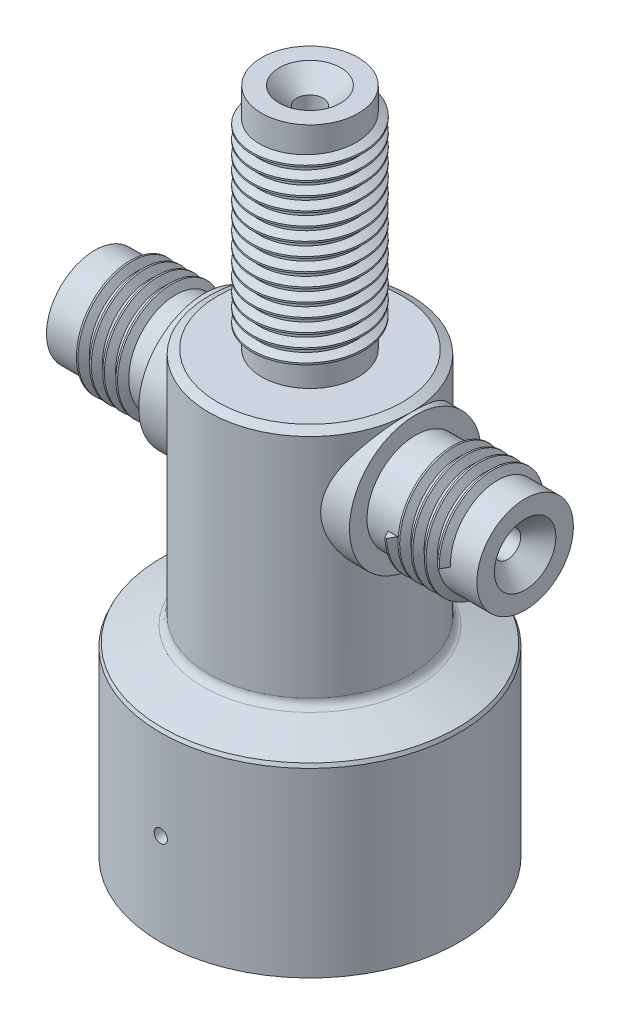
from build123d import *

# Parameters (mm, degrees)
CHAMFER_1_SIZE      = 0.2
CHAMFER_1_SIZE2     = 0.334631437
FILLET_2_R          = 1
SKETCH_7_R          = 5.5
EXTRUDE_3_DEPTH     = 24.5
EXTRUDE_START       = -24.5
SKETCH_8_R          = 5.5
EXTRUDE_4_DEPTH     = 24.5
SKETCH_9_R          = 7.5
EXTRUDE_5_DEPTH     = 12
EXTRUDE_START_2     = -12
SKETCH_10_R         = 7.5
EXTRUDE_6_DEPTH     = 12
THREAD_1_PITCH      = 1.5
THREAD_2_PITCH      = 1.5
THREAD_3_PITCH      = 1.5
SKETCH_24_R         = 1.5
CUT_EXTRUDE_1_DEPTH = 10
CHAMFER_2_SIZE      = 2
SKETCH_25_R         = 1.5
CUT_EXTRUDE_2_DEPTH = 82.6409825
CHAMFER_3_SIZE      = 2
CUT_EXTRUDE_START   = -10
SKETCH_26_R         = 1.5
CUT_EXTRUDE_3_DEPTH = 10
CHAMFER_4_SIZE      = 2
SKETCH_27_R         = 13
CUT_EXTRUDE_4_DEPTH = 16
CHAMFER_5_SIZE      = 0.8
CHAMFER_5_SIZE2     = 0.461880215
THREAD_4_PITCH      = 1.5
SKETCH_32_R         = 9
CUT_EXTRUDE_5_DEPTH = 20
SKETCH_33_R         = 11.5
SKETCH_33_R_2       = 10
EXTRUDE_8_DEPTH     = 1
FILLET_3_R          = 0.4
CHAMFER_6_SIZE2     = 0.577350269
CHAMFER_6_SIZE      = 1
SKETCH_34_R         = 5
CUT_EXTRUDE_7_DEPTH = 6
SKETCH_35_R         = 3
SKETCH_35_R_2       = 1.5
EXTRUDE_9_DEPTH     = 1
FILLET_5_R          = 1
SKETCH_36_R         = 0.75
CUT_EXTRUDE_8_DEPTH = 11
CHAMFER_7_SIZE2     = 0.5
CHAMFER_7_SIZE      = 1


with BuildPart() as part:
    # Sketch 2 → Повернуть2 (revolve)
    with BuildSketch(Plane.XY, mode=Mode.PRIVATE) as revolve_2_sk:
        Polygon((0, 0), (-17, 0), (-17, 21), (-11.5, 23.001836288), (-11.5, 50), (-5.5, 50), (-5.5, 76), (0, 76), align=None)
    revolve(revolve_2_sk.sketch.rotate(Axis((0, 76, 0), (0, -1, 0)), 270), axis=Axis((0, 76, 0), (0, -1, 0)))

    # Фаска1
    chamfer_1_edges = [part.edges().sort_by_distance(p)[0] for p in [
        (0, 21, -17),
    ]]
    chamfer_1_side = [part.faces().sort_by_distance(p)[0] for p in [
        (0, 22.000918144, -14.25),
    ]]
    chamfer(chamfer_1_edges, length=CHAMFER_1_SIZE, length2=CHAMFER_1_SIZE2, reference=chamfer_1_side[0])

    # Скругление2
    fillet_2_edges = [part.edges().sort_by_distance(p)[0] for p in [
        (0, 23.001836288, -11.5),
    ]]
    fillet(fillet_2_edges, radius=FILLET_2_R)

    # Эскиз7 → Бобышка-Вытянуть3 (add)
    with BuildSketch(Plane(origin=(0, 0, 0), x_dir=(0, 0, -1), z_dir=(1, 0, 0))):
        with Locations(Location((0, 42, 0), (0, 0, 180))):
            Circle(SKETCH_7_R)
    extrude(amount=EXTRUDE_3_DEPTH)

    # Эскиз8 → Бобышка-Вытянуть4 (add)
    with BuildSketch(Plane(origin=(0, 0, 0), x_dir=(0, 0, -1), z_dir=(1, 0, 0)).offset(EXTRUDE_START)):
        with Locations(Location((0, 42, 0), (0, 0, 180))):
            Circle(SKETCH_8_R)
    extrude(amount=EXTRUDE_4_DEPTH)

    # Эскиз9 → Бобышка-Вытянуть5 (add)
    with BuildSketch(Plane(origin=(0, 0, 0), x_dir=(0, 0, -1), z_dir=(1, 0, 0))):
        with Locations(Location((0, 42, 0), (0, 0, 180))):
            Circle(SKETCH_9_R)
    extrude(amount=EXTRUDE_5_DEPTH)

    # Эскиз10 → Бобышка-Вытянуть6 (add)
    with BuildSketch(Plane(origin=(0, 0, 0), x_dir=(0, 0, -1), z_dir=(1, 0, 0)).offset(EXTRUDE_START_2)):
        with Locations(Location((0, 42, 0), (0, 0, 180))):
            Circle(SKETCH_10_R)
    extrude(amount=EXTRUDE_6_DEPTH)

    # Резьба1: the profile of Sketch 2 2 profile screwed along a right-hand helix of 4 turns, 8 arcs to a turn; built about Z, then put on its axis
    thread_1_z = Axis((0, 0, 0), (0, 0, 1))
    thread_1_corners = [(5.4997, 0, -0.000173205), (6.311898812, 0, 0.468749998), (6.311898812, 0, 0.656249998), (5.4997, 0, 1.125173201)]
    with BuildLine(mode=Mode.PRIVATE) as thread_1_profile:
        Line(thread_1_corners[0], thread_1_corners[1])
        Line(thread_1_corners[1], thread_1_corners[2])
        Line(thread_1_corners[2], thread_1_corners[3])
        Line(thread_1_corners[3], thread_1_corners[0])
    thread_1_cap = Face(thread_1_profile.wire())
    thread_1_turn_angles = [0, 22.5, 45, 67.5, 90, 112.5, 135, 157.5, 180, 202.5, 225, 247.5, 270, 292.5, 315, 337.5, 360]
    thread_1_turn_weights = [1, 0.9238795325112867, 1, 0.9238795325112867, 1, 0.9238795325112867, 1, 0.9238795325112867, 1, 0.9238795325112867, 1, 0.9238795325112867, 1, 0.9238795325112867, 1, 0.9238795325112867, 1]
    thread_1_turn_rails = [Edge.make_bspline([Vector(p[0], p[1], 0).rotate(thread_1_z, thread_1_turn_angles[k]) / thread_1_turn_weights[k] + Vector(0, 0, p[2] + THREAD_1_PITCH * thread_1_turn_angles[k] / 360) for k in range(17)], [0, 0, 0, 1, 1, 2, 2, 3, 3, 4, 4, 5, 5, 6, 6, 7, 7, 8, 8, 8], 2, thread_1_turn_weights) for p in thread_1_corners]
    thread_1_turn_sides = [Face.make_surface_from_curves(thread_1_turn_rails[p[0]], thread_1_turn_rails[p[1]]) for p in [(0, 1), (1, 2), (2, 3), (3, 0)]]
    thread_1 = Plane(origin=(21.5, 42, 0), x_dir=(0, 0, 1), z_dir=(-1, 0, 0)) * Solid(Shell([*[p.moved(Location((0, 0, THREAD_1_PITCH * i))) for i in range(4) for p in thread_1_turn_sides], thread_1_cap, thread_1_cap.rotate(thread_1_z, 1440).moved(Location((0, 0, THREAD_1_PITCH * 1440 / 360)))]))
    add(thread_1)

    # Резьба2: the profile of Профиль резьбы3 profile screwed along a right-hand helix of 4 turns, 8 arcs to a turn; built about Z, then put on its axis
    thread_2_z = Axis((0, 0, 0), (0, 0, 1))
    thread_2_corners = [(5.4997, 0, -0.000173205), (6.311898812, 0, 0.468749998), (6.311898812, 0, 0.656249998), (5.4997, 0, 1.125173201)]
    with BuildLine(mode=Mode.PRIVATE) as thread_2_profile:
        Line(thread_2_corners[0], thread_2_corners[1])
        Line(thread_2_corners[1], thread_2_corners[2])
        Line(thread_2_corners[2], thread_2_corners[3])
        Line(thread_2_corners[3], thread_2_corners[0])
    thread_2_cap = Face(thread_2_profile.wire())
    thread_2_turn_angles = [0, 22.5, 45, 67.5, 90, 112.5, 135, 157.5, 180, 202.5, 225, 247.5, 270, 292.5, 315, 337.5, 360]
    thread_2_turn_weights = [1, 0.9238795325112867, 1, 0.9238795325112867, 1, 0.9238795325112867, 1, 0.9238795325112867, 1, 0.9238795325112867, 1, 0.9238795325112867, 1, 0.9238795325112867, 1, 0.9238795325112867, 1]
    thread_2_turn_rails = [Edge.make_bspline([Vector(p[0], p[1], 0).rotate(thread_2_z, thread_2_turn_angles[k]) / thread_2_turn_weights[k] + Vector(0, 0, p[2] + THREAD_2_PITCH * thread_2_turn_angles[k] / 360) for k in range(17)], [0, 0, 0, 1, 1, 2, 2, 3, 3, 4, 4, 5, 5, 6, 6, 7, 7, 8, 8, 8], 2, thread_2_turn_weights) for p in thread_2_corners]
    thread_2_turn_sides = [Face.make_surface_from_curves(thread_2_turn_rails[p[0]], thread_2_turn_rails[p[1]]) for p in [(0, 1), (1, 2), (2, 3), (3, 0)]]
    thread_2 = Plane(origin=(-21.5, 42, 0), x_dir=(0, 0, -1), z_dir=(1, 0, 0)) * Solid(Shell([*[p.moved(Location((0, 0, THREAD_2_PITCH * i))) for i in range(4) for p in thread_2_turn_sides], thread_2_cap, thread_2_cap.rotate(thread_2_z, 1440).moved(Location((0, 0, THREAD_2_PITCH * 1440 / 360)))]))
    add(thread_2)

    # Резьба3: the profile of Профиль резьбы4 profile screwed along a right-hand helix of 14 turns, 8 arcs to a turn; built about Z, then put on its axis
    thread_3_z = Axis((0, 0, 0), (0, 0, 1))
    thread_3_corners = [(5.4997, 0, -0.000173205), (6.311898812, 0, 0.468749998), (6.311898812, 0, 0.656249998), (5.4997, 0, 1.125173201)]
    with BuildLine(mode=Mode.PRIVATE) as thread_3_profile:
        Line(thread_3_corners[0], thread_3_corners[1])
        Line(thread_3_corners[1], thread_3_corners[2])
        Line(thread_3_corners[2], thread_3_corners[3])
        Line(thread_3_corners[3], thread_3_corners[0])
    thread_3_cap = Face(thread_3_profile.wire())
    thread_3_turn_angles = [0, 22.5, 45, 67.5, 90, 112.5, 135, 157.5, 180, 202.5, 225, 247.5, 270, 292.5, 315, 337.5, 360]
    thread_3_turn_weights = [1, 0.9238795325112867, 1, 0.9238795325112867, 1, 0.9238795325112867, 1, 0.9238795325112867, 1, 0.9238795325112867, 1, 0.9238795325112867, 1, 0.9238795325112867, 1, 0.9238795325112867, 1]
    thread_3_turn_rails = [Edge.make_bspline([Vector(p[0], p[1], 0).rotate(thread_3_z, thread_3_turn_angles[k]) / thread_3_turn_weights[k] + Vector(0, 0, p[2] + THREAD_3_PITCH * thread_3_turn_angles[k] / 360) for k in range(17)], [0, 0, 0, 1, 1, 2, 2, 3, 3, 4, 4, 5, 5, 6, 6, 7, 7, 8, 8, 8], 2, thread_3_turn_weights) for p in thread_3_corners]
    thread_3_turn_sides = [Face.make_surface_from_curves(thread_3_turn_rails[p[0]], thread_3_turn_rails[p[1]]) for p in [(0, 1), (1, 2), (2, 3), (3, 0)]]
    thread_3 = Plane(origin=(0, 74, 0), x_dir=(-1, 0, 0), z_dir=(0, -1, 0)) * Solid(Shell([*[p.moved(Location((0, 0, THREAD_3_PITCH * i))) for i in range(14) for p in thread_3_turn_sides], thread_3_cap, thread_3_cap.rotate(thread_3_z, 5040).moved(Location((0, 0, THREAD_3_PITCH * 5040 / 360)))]))
    add(thread_3)

    # Эскиз24 → Вырез-Вытянуть1 (cut)
    with BuildSketch(Plane(origin=(24.5, 0, 0), x_dir=(0, 0, -1), z_dir=(1, 0, 0))):
        with Locations((0, 42)):
            Circle(SKETCH_24_R)
    extrude(amount=-CUT_EXTRUDE_1_DEPTH, mode=Mode.SUBTRACT)

    # Фаска2
    chamfer_2_edges = [part.edges().sort_by_distance(p)[0] for p in [
        (24.5, 42, 1.5),
    ]]
    chamfer(chamfer_2_edges, length=CHAMFER_2_SIZE)

    # Эскиз25 → Вырез-Вытянуть2 (cut, through all)
    with BuildSketch(Plane(origin=(0, 76, 0), x_dir=(1, 0, 0), z_dir=(0, 1, 0))):
        with Locations(Location((0, 0, 0), (0, 0, 270))):
            Circle(SKETCH_25_R)
    extrude(amount=-CUT_EXTRUDE_2_DEPTH, mode=Mode.SUBTRACT)

    # Фаска3
    chamfer_3_edges = [part.edges().sort_by_distance(p)[0] for p in [
        (0, 76, -1.5),
    ]]
    chamfer(chamfer_3_edges, length=CHAMFER_3_SIZE)

    # Эскиз26 → Вырез-Вытянуть3 (cut)
    with BuildSketch(Plane.ZY.offset(24.5).offset(CUT_EXTRUDE_START)):
        with Locations(Location((0, 42, 0), (0, 0, 180))):
            Circle(SKETCH_26_R)
    extrude(amount=CUT_EXTRUDE_3_DEPTH, mode=Mode.SUBTRACT)

    # Фаска4
    chamfer_4_edges = [part.edges().sort_by_distance(p)[0] for p in [
        (-24.5, 42, 1.5),
    ]]
    chamfer(chamfer_4_edges, length=CHAMFER_4_SIZE)

    # Эскиз27 → Вырез-Вытянуть4 (cut)
    with BuildSketch(Plane(origin=(0, 0, 0), x_dir=(-1, 0, 0), z_dir=(0, -1, 0))):
        with Locations(Location((0, 0, 0), (0, 0, 90))):
            Circle(SKETCH_27_R)
    extrude(amount=-CUT_EXTRUDE_4_DEPTH, mode=Mode.SUBTRACT)

    # Фаска5
    chamfer_5_edges = [part.edges().sort_by_distance(p)[0] for p in [
        (0, 0, 13),
    ]]
    chamfer_5_side = [part.faces().sort_by_distance(p)[0] for p in [
        (0, 0, -16.519167389),
    ]]
    chamfer(chamfer_5_edges, length=CHAMFER_5_SIZE, length2=CHAMFER_5_SIZE2, reference=chamfer_5_side[0])

    # Резьба4: the profile of Профиль резьбы6 profile screwed along a right-hand helix of 14 turns, 8 arcs to a turn; built about Z, then put on its axis
    thread_4_z = Axis((0, 0, 0), (0, 0, 1))
    thread_4_corners = [(12.9997, 0, -0.000173205), (13.811898813, 0, 0.468749998), (13.811898813, 0, 0.656249998), (12.9997, 0, 1.125173201)]
    with BuildLine(mode=Mode.PRIVATE) as thread_4_profile:
        Line(thread_4_corners[0], thread_4_corners[1])
        Line(thread_4_corners[1], thread_4_corners[2])
        Line(thread_4_corners[2], thread_4_corners[3])
        Line(thread_4_corners[3], thread_4_corners[0])
    thread_4_cap = Face(thread_4_profile.wire())
    thread_4_turn_angles = [0, 22.5, 45, 67.5, 90, 112.5, 135, 157.5, 180, 202.5, 225, 247.5, 270, 292.5, 315, 337.5, 360]
    thread_4_turn_weights = [1, 0.9238795325112867, 1, 0.9238795325112867, 1, 0.9238795325112867, 1, 0.9238795325112867, 1, 0.9238795325112867, 1, 0.9238795325112867, 1, 0.9238795325112867, 1, 0.9238795325112867, 1]
    thread_4_turn_rails = [Edge.make_bspline([Vector(p[0], p[1], 0).rotate(thread_4_z, thread_4_turn_angles[k]) / thread_4_turn_weights[k] + Vector(0, 0, p[2] + THREAD_4_PITCH * thread_4_turn_angles[k] / 360) for k in range(17)], [0, 0, 0, 1, 1, 2, 2, 3, 3, 4, 4, 5, 5, 6, 6, 7, 7, 8, 8, 8], 2, thread_4_turn_weights) for p in thread_4_corners]
    thread_4_turn_sides = [Face.make_surface_from_curves(thread_4_turn_rails[p[0]], thread_4_turn_rails[p[1]]) for p in [(0, 1), (1, 2), (2, 3), (3, 0)]]
    thread_4 = Plane(origin=(0, 13, 0), x_dir=(-1, 0, 0), z_dir=(0, -1, 0)) * Solid(Shell([*[p.moved(Location((0, 0, THREAD_4_PITCH * i))) for i in range(14) for p in thread_4_turn_sides], thread_4_cap, thread_4_cap.rotate(thread_4_z, 5040).moved(Location((0, 0, THREAD_4_PITCH * 5040 / 360)))]))
    add(thread_4, mode=Mode.SUBTRACT)

    # Эскиз32 → Вырез-Вытянуть5 (cut)
    with BuildSketch(Plane(origin=(0, 16, 0), x_dir=(-1, 0, 0), z_dir=(0, -1, 0))):
        with Locations(Location((0, 0, 0), (0, 0, 90))):
            Circle(SKETCH_32_R)
    extrude(amount=-CUT_EXTRUDE_5_DEPTH, mode=Mode.SUBTRACT)

    # Эскиз33 → Бобышка-Вытянуть8 (add)
    with BuildSketch(Plane(origin=(0, 16, 0), x_dir=(-1, 0, 0), z_dir=(0, -1, 0))):
        with Locations(Location((0, 0, 0), (0, 0, 270))):
            Circle(SKETCH_33_R)
        with Locations(Location((0, 0, 0), (0, 0, 90))):
            Circle(SKETCH_33_R_2, mode=Mode.SUBTRACT)
    extrude(amount=EXTRUDE_8_DEPTH)

    # Скругление3
    fillet_3_edges = [part.edges().sort_by_distance(p)[0] for p in [
        (0, 15, -11.5),
    ]]
    fillet(fillet_3_edges, radius=FILLET_3_R)

    # Фаска6
    chamfer_6_edges = [part.edges().sort_by_distance(p)[0] for p in [
        (0, 16, 9),
    ]]
    chamfer_6_side = [part.faces().sort_by_distance(p)[0] for p in [
        (0, 16, 9.011547005),
    ]]
    chamfer(chamfer_6_edges, length=CHAMFER_6_SIZE - 0.0001, length2=CHAMFER_6_SIZE2 - 0.0001, reference=chamfer_6_side[0])  # a hair under: the kernel refuses the full size

    # Эскиз34 → Вырез-Вытянуть7 (cut)
    with BuildSketch(Plane.XZ.offset(-36)):
        with Locations(Location((0, 0, 0), (0, 0, 270))):
            Circle(SKETCH_34_R)
    extrude(amount=-CUT_EXTRUDE_7_DEPTH, mode=Mode.SUBTRACT)

    # Эскиз35 → Бобышка-Вытянуть9 (add)
    with BuildSketch(Plane.XZ.offset(-42)):
        with Locations(Location((0, 0, 0), (0, 0, 270))):
            Circle(SKETCH_35_R)
        with Locations(Location((0, 0, 0), (0, 0, 90))):
            Circle(SKETCH_35_R_2, mode=Mode.SUBTRACT)
    extrude(amount=EXTRUDE_9_DEPTH)

    # Скругление5
    fillet_5_edges = [part.edges().sort_by_distance(p)[0] for p in [
        (0, 41, 3),
    ]]
    fillet(fillet_5_edges, radius=FILLET_5_R - 0.0001)  # a hair under: the kernel refuses the full size

    # Эскиз36 → Вырез-Вытянуть8 (cut)
    with BuildSketch(Plane.XY.offset(17)):
        with Locations(Location((0, 10.5, 0), (0, 0, 351.416655453))):
            Circle(SKETCH_36_R)
    extrude(amount=-CUT_EXTRUDE_8_DEPTH, mode=Mode.SUBTRACT)

    # Фаска7
    chamfer_7_edges = [part.edges().sort_by_distance(p)[0] for p in [
        (0, 50, -11.5),
    ]]
    chamfer_7_side = [part.faces().sort_by_distance(p)[0] for p in [
        (0, 50, -11.49),
    ]]
    chamfer(chamfer_7_edges, length=CHAMFER_7_SIZE - 0.0001, length2=CHAMFER_7_SIZE2 - 0.0001, reference=chamfer_7_side[0])  # a hair under: the kernel refuses the full size


solid = part.part
